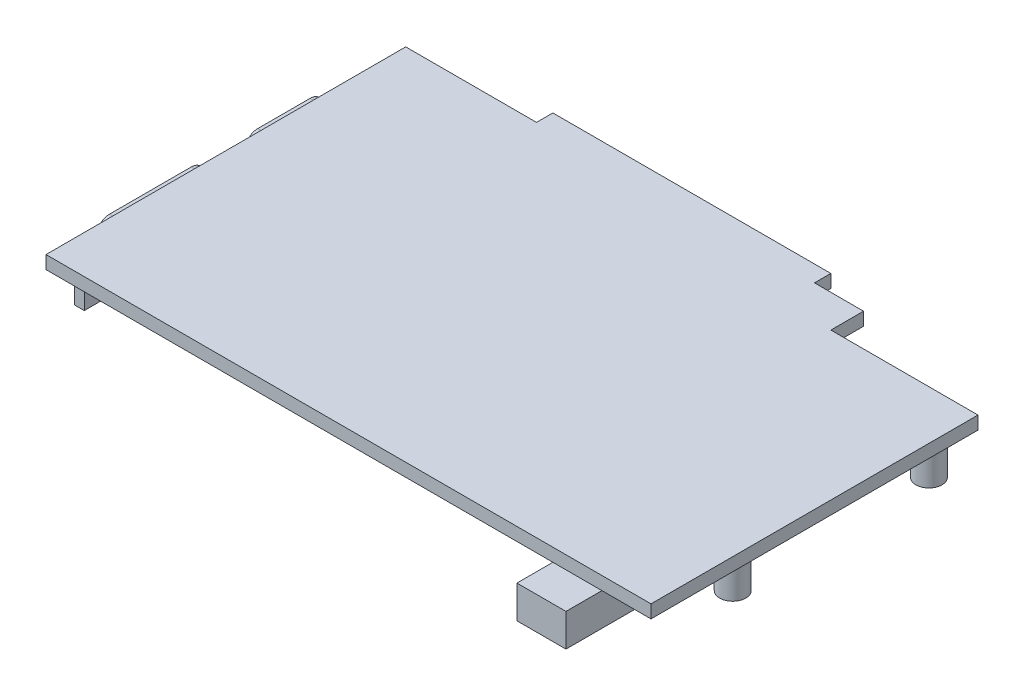
from build123d import *

# Parameters (mm, degrees)
SKETCH1_W               = 185
SKETCH1_H               = 100
BOSS_EXTRUDE1_DEPTH     = 4
BOSS_EXTRUDE2_DEPTH     = 4
SKETCH3_W               = 10
SKETCH3_H               = 100
BOSS_EXTRUDE3_DEPTH     = 15
SKETCH4_W               = 20
SKETCH4_H               = 70
BOSS_EXTRUDE4_DEPTH     = 6
SKETCH5_W               = 15
SKETCH5_H               = 20
BOSS_EXTRUDE5_DEPTH     = 10
SKETCH6_R               = 4
BOSS_EXTRUDE6_DEPTH     = 10
SKETCH7_OUTSIDE_W       = 162.144
SKETCH7_OUTSIDE_H       = 66.144
CUT_EXTRUDE1_DEPTH      = 7
CUT_EXTRUDE2_DEPTH      = 7
CUT_EXTRUDE2_DEPTH_BACK = 7
SKETCH8_R               = 1.25
SKETCH9_W               = 15
SKETCH9_H               = 10
BOSS_EXTRUDE7_DEPTH     = 11
SKETCH10_W              = 91
SKETCH10_H              = 73
BOSS_EXTRUDE8_DEPTH     = 18


with BuildPart() as part:
    # Sketch1 → Boss-Extrude1 (new body)
    with BuildSketch(Plane(origin=(0, 0, 0), x_dir=(1, 0, 0), z_dir=(0, 1, 0))):
        with Locations((92.5, 50)):
            Rectangle(SKETCH1_W, SKETCH1_H)
    extrude(amount=BOSS_EXTRUDE1_DEPTH)

    # Sketch2 → Boss-Extrude2 (add)
    with BuildSketch(Plane(origin=(0, 4, 0), x_dir=(-1, 0, 0), z_dir=(0, 1, 0))):
        Polygon((-40, -115), (-40, -110), (0, -110), (0, -100), (-140, -100), (-140, -110), (-125, -110), (-125, -115), align=None)
    extrude(amount=-BOSS_EXTRUDE2_DEPTH)

    # Sketch3 → Boss-Extrude3 (add)
    with BuildSketch(Plane.XZ):
        with Locations((-3.300721775, -60)):
            Rectangle(SKETCH3_W, SKETCH3_H)
    extrude(amount=BOSS_EXTRUDE3_DEPTH)

    # Sketch4 → Boss-Extrude4 (add)
    with BuildSketch(Plane.XZ):
        with Locations((137.629312938, -55)):
            Rectangle(SKETCH4_W, SKETCH4_H)
    extrude(amount=BOSS_EXTRUDE4_DEPTH)

    # Sketch5 → Boss-Extrude5 (add)
    with BuildSketch(Plane.XZ):
        with Locations((162.5, -10)):
            Rectangle(SKETCH5_W, SKETCH5_H)
    extrude(amount=BOSS_EXTRUDE5_DEPTH)

    # Sketch6 → Boss-Extrude6 (add)
    with BuildSketch(Plane.XZ):
        with Locations((180, -30)):
            Circle(SKETCH6_R)
        with Locations((180, -90)):
            Circle(SKETCH6_R)
    extrude(amount=BOSS_EXTRUDE6_DEPTH)

    # Sketch7 outside → Cut-Extrude1 (cut)
    with BuildSketch(Plane.ZY.offset(8.300721775)):
        with Locations((-57.5, -5.5)):
            Rectangle(SKETCH7_OUTSIDE_W, SKETCH7_OUTSIDE_H)
        with BuildLine():
            Line((-27.721260458, -11.311695685), (-52.721260458, -11.311695685))
            ThreePointArc((-52.721260458, -11.311695685), (-56.721260458, -7.311695685), (-52.721260458, -3.311695685))
            Line((-52.721260458, -3.311695685), (-27.721260458, -3.311695685))
            ThreePointArc((-27.721260458, -3.311695685), (-23.721260458, -7.311695685), (-27.721260458, -11.311695685))
        make_face(mode=Mode.SUBTRACT)
        with BuildLine():
            Line((-73.057716075, -11.311695685), (-89.057716075, -11.311695685))
            ThreePointArc((-89.057716075, -11.311695685), (-93.057716075, -7.311695685), (-89.057716075, -3.311695685))
            Line((-89.057716075, -3.311695685), (-73.057716075, -3.311695685))
            ThreePointArc((-73.057716075, -3.311695685), (-69.057716075, -7.311695685), (-73.057716075, -11.311695685))
        make_face(mode=Mode.SUBTRACT)
    extrude(amount=-CUT_EXTRUDE1_DEPTH, mode=Mode.SUBTRACT)

    # Sketch8 → Cut-Extrude2 (cut, two sides: drawn at the far end of the back side and taken through both)
    with BuildSketch(Plane.ZY.offset(1.300721775).offset(-CUT_EXTRUDE2_DEPTH_BACK)):
        with Locations((-24.221260458, -7.311695685)):
            Circle(SKETCH8_R)
        with Locations((-56.221260458, -7.311695685)):
            Circle(SKETCH8_R)
        with Locations((-68.807716075, -7.311695685)):
            Circle(SKETCH8_R)
        with Locations((-93.307716075, -7.311695685)):
            Circle(SKETCH8_R)
    extrude(amount=CUT_EXTRUDE2_DEPTH + CUT_EXTRUDE2_DEPTH_BACK, mode=Mode.SUBTRACT)

    # Sketch9 → Boss-Extrude7 (add)
    with BuildSketch(Plane.XY):
        with Locations((162.5, -5)):
            Rectangle(SKETCH9_W, SKETCH9_H)
    extrude(amount=BOSS_EXTRUDE7_DEPTH)

    # Sketch10 → Boss-Extrude8 (add)
    with BuildSketch(Plane.XZ):
        with Locations((82.5, -58.5)):
            Rectangle(SKETCH10_W, SKETCH10_H)
    extrude(amount=BOSS_EXTRUDE8_DEPTH)


solid = part.part
